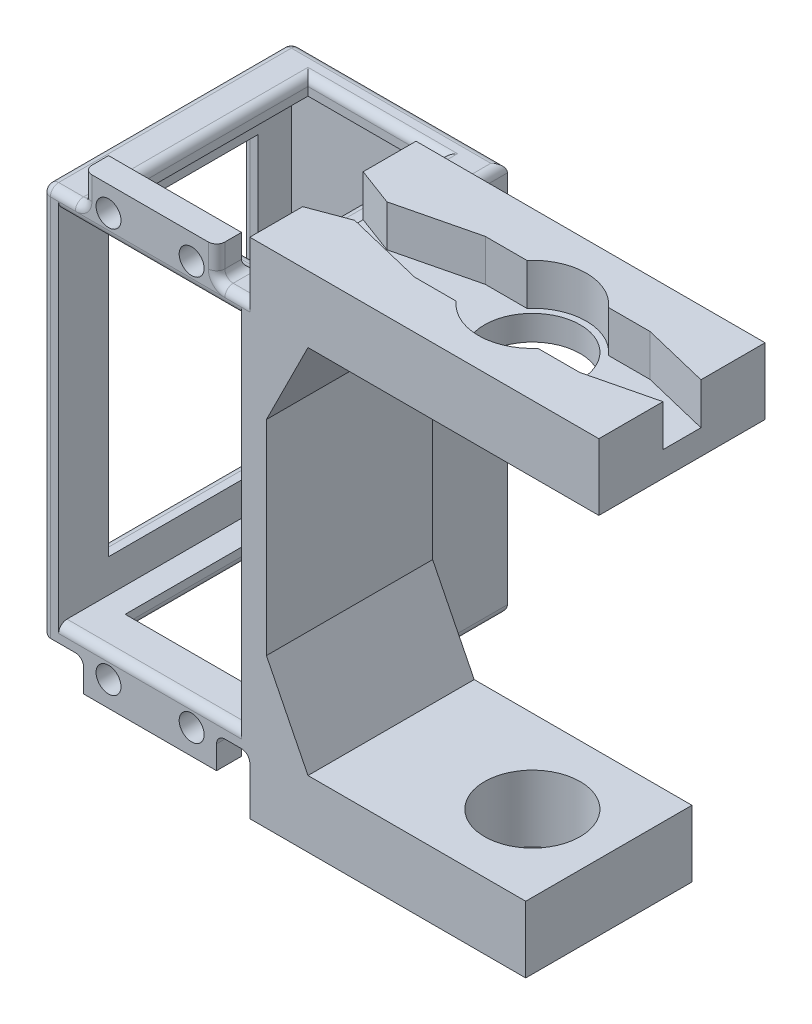
from build123d import *

# Parameters (mm, degrees)
SKETCH1_W               = 26
SKETCH1_H               = 47
BOSS_EXTRUDE1_DEPTH     = 30
SHELL1_T                = -2
SKETCH2_W               = 10
SKETCH2_H               = 0.8
BOSS_EXTRUDE2_DEPTH     = 3
SKETCH3_R               = 1.5
CUT_EXTRUDE1_DEPTH      = 3
BOSS_EXTRUDE3_DEPTH     = 20
CUT_EXTRUDE2_DEPTH      = 82.134209801
CUT_EXTRUDE2_DEPTH_BACK = 82.134209801
SKETCH6_R               = 4.5
BOSS_EXTRUDE4_DEPTH     = 8
CUT_EXTRUDE3_DEPTH      = 82.917275345
CUT_EXTRUDE3_DEPTH_BACK = 82.917275345
SKETCH9_R               = 5.75
CUT_EXTRUDE4_DEPTH      = 5
SKETCH10_W              = 18
SKETCH10_H              = 35
CUT_EXTRUDE5_DEPTH      = 5
FILLET1_R               = 1
FILLET2_R               = 1
FILLET3_R               = 1
FILLET5_R               = 1
FILLET6_R               = 1
SKETCH11_W              = 8.801922924
SKETCH11_H              = 20
CUT_EXTRUDE6_DEPTH      = 10


# Some blends are built 0.0001 mm under size
with BuildPart() as part:
    # Sketch1 → Boss-Extrude1 (new body)
    with BuildSketch(Plane.XY):
        Rectangle(SKETCH1_W, SKETCH1_H)
    extrude(amount=BOSS_EXTRUDE1_DEPTH)

    # Shell1
    shell1_openings = [part.faces().sort_by_distance(p)[0] for p in [
        (0, 0, 30),
    ]]
    offset(amount=SHELL1_T, openings=shell1_openings, kind=Kind.INTERSECTION)

    # Sketch2 → Boss-Extrude2 (add)
    with BuildSketch(Plane.XY.offset(30)):
        Polygon((-5, 23.5), (-5, 24.3), (5, 24.3), (5, 23.5), (8, 23.5), (8, 27.3), (-8, 27.3), (-8, 23.5), align=None)
        with Locations((0, 23.9)):
            Rectangle(SKETCH2_W, SKETCH2_H)
        Polygon((-5, -24.3), (-5, -23.5), (-8, -23.5), (-8, -27.3), (8, -27.3), (8, -23.5), (5, -23.5), (5, -24.3), align=None)
        with Locations((0, -23.9)):
            Rectangle(SKETCH2_W, SKETCH2_H)
    extrude(amount=-BOSS_EXTRUDE2_DEPTH)

    # Sketch3 → Cut-Extrude1 (cut)
    with BuildSketch(Plane.XY.offset(30)):
        with Locations((-5, -24.3)):
            Circle(SKETCH3_R)
        with Locations((5, -24.3)):
            Circle(SKETCH3_R)
        with Locations((5, 24.3)):
            Circle(SKETCH3_R)
        with Locations((-5, 24.3)):
            Circle(SKETCH3_R)
    extrude(amount=-CUT_EXTRUDE1_DEPTH, mode=Mode.SUBTRACT)

    # Sketch4 → Boss-Extrude3 (add)
    with BuildSketch(Plane.XY.offset(30)):
        Polygon((13, 23.5), (13, -23.5), (12, -23.5), (12, -30.3), (54, -30.3), (54, -22.3), (19, -22.3), (14, -12.3), (14, 12.3), (19, 22.3), (54, 22.3), (54, 30.3), (12, 30.3), (12, 23.5), align=None)
    extrude(amount=-BOSS_EXTRUDE3_DEPTH)

    # Sketch5 → Cut-Extrude2 (cut, two sides: drawn at the far end of the back side and taken through both)
    with BuildSketch(Plane(origin=(0, 22.3, 0), x_dir=(-1, 0, 0), z_dir=(0, -1, 0)).offset(-CUT_EXTRUDE2_DEPTH_BACK)):
        with BuildLine():
            ThreePointArc((-36, -14.25), (-41.75, -20), (-36, -25.75))
            Line((-36, -25.75), (-36, -14.25))
        make_face()
        with BuildLine():
            Line((-36, -14.25), (-36, -25.75))
            ThreePointArc((-36, -25.75), (-31.934136008, -24.065863992), (-30.25, -20))
            ThreePointArc((-30.25, -20), (-31.934136008, -15.934136008), (-36, -14.25))
        make_face()
    extrude(amount=CUT_EXTRUDE2_DEPTH + CUT_EXTRUDE2_DEPTH_BACK, mode=Mode.SUBTRACT)

    # Sketch6 → Boss-Extrude4 (add)
    with BuildSketch(Plane(origin=(0, 0, 0), x_dir=(-1, 0, 0), z_dir=(0, 0, -1))):
        with Locations((0, -10)):
            Circle(SKETCH6_R)
    extrude(amount=BOSS_EXTRUDE4_DEPTH)

    # Sketch7 → Cut-Extrude3 (cut, two sides: drawn at the far end of the back side and taken through both)
    with BuildSketch(Plane(origin=(0, 23.5, 0), x_dir=(1, 0, 0), z_dir=(0, 1, 0)).offset(-CUT_EXTRUDE3_DEPTH_BACK)):
        Polygon((-8, -25), (8, -25), (8, -23), (8, -5), (8, -3), (-8, -3), (-8, -5), (-8, -23), align=None)
    extrude(amount=CUT_EXTRUDE3_DEPTH + CUT_EXTRUDE3_DEPTH_BACK, mode=Mode.SUBTRACT)

    # Sketch9 → Cut-Extrude4 (cut)
    with BuildSketch(Plane(origin=(0, 30.3, 0), x_dir=(1, 0, 0), z_dir=(0, 1, 0))):
        with BuildLine():
            Line((31.081921107, -15.75), (26.081921107, -15.75))
            Line((26.081921107, -15.75), (16.559525756, -18.066028235))
            Line((16.559525756, -18.066028235), (12, -16.361741342))
            Line((12, -16.361741342), (12, -23.638258658))
            Line((12, -23.638258658), (16.559525756, -21.933971765))
            Line((16.559525756, -21.933971765), (26.081921107, -24.25))
            Line((26.081921107, -24.25), (31.081921107, -24.25))
            ThreePointArc((31.081921107, -24.25), (36, -26.5), (40.918078893, -24.25))
            Line((40.918078893, -24.25), (45.918078893, -24.25))
            Line((45.918078893, -24.25), (54, -22.284322585))
            Line((54, -22.284322585), (54, -17.715677415))
            Line((54, -17.715677415), (45.918078893, -15.75))
            Line((45.918078893, -15.75), (40.918078893, -15.75))
            ThreePointArc((40.918078893, -15.75), (36, -13.5), (31.081921107, -15.75))
        make_face()
        with Locations(Location((36, -20, 0), (0, 0, 90))):
            Circle(SKETCH9_R, mode=Mode.SUBTRACT)
    extrude(amount=-CUT_EXTRUDE4_DEPTH, mode=Mode.SUBTRACT)

    # Sketch10 → Cut-Extrude5 (cut)
    with BuildSketch(Plane.ZY.offset(13)):
        with Locations((15, 0)):
            Rectangle(SKETCH10_W, SKETCH10_H)
    extrude(amount=-CUT_EXTRUDE5_DEPTH, mode=Mode.SUBTRACT)

    # Fillet1
    fillet1_edges = [part.edges().sort_by_distance(p)[0] for p in [
        (0, -21.5, 30),
        (-13, 17.5, 15),
        (-13, 0, 24),
        (-13, 0, 6),
        (-13, -17.5, 15),
    ]]
    fillet(fillet1_edges, radius=FILLET1_R)

    # Fillet2
    # the kernel refuses this fillet: 1 mm, written as the material it adds along each edge
    with BuildSketch(Plane(origin=(8, 23.5, 30), x_dir=(1, 0, 0), z_dir=(0, 0, -1))) as fillet2_piece_1:
        with BuildLine():
            CenterArc((FILLET2_R, -FILLET2_R), FILLET2_R, 90, 90)
            Line((0, -FILLET2_R), (-FILLET2_R * 0.02, -FILLET2_R))
            Line((-FILLET2_R * 0.02, -FILLET2_R), (-FILLET2_R * 0.02, FILLET2_R * 0.02))
            Line((-FILLET2_R * 0.02, FILLET2_R * 0.02), (FILLET2_R, FILLET2_R * 0.02))
            Line((FILLET2_R, FILLET2_R * 0.02), (FILLET2_R, 0))
        make_face()
    extrude(amount=3)
    with BuildSketch(Plane(origin=(-8, 23.5, 30), x_dir=(-1, 0, 0), z_dir=(0, 0, -1))) as fillet2_piece_2:
        with BuildLine():
            CenterArc((FILLET2_R, FILLET2_R), FILLET2_R, 180, 90)
            Line((0, FILLET2_R), (-FILLET2_R * 0.02, FILLET2_R))
            Line((-FILLET2_R * 0.02, FILLET2_R), (-FILLET2_R * 0.02, -FILLET2_R * 0.02))
            Line((-FILLET2_R * 0.02, -FILLET2_R * 0.02), (FILLET2_R, -FILLET2_R * 0.02))
            Line((FILLET2_R, -FILLET2_R * 0.02), (FILLET2_R, 0))
        make_face()
    extrude(amount=3)
    with BuildSketch(Plane(origin=(3.768857754, 23.5, 27), x_dir=(0, 0, -1), z_dir=(1, 0, 0))) as fillet2_piece_3_section:
        with BuildLine():
            CenterArc((FILLET2_R, FILLET2_R), FILLET2_R, 180, 90)
            Line((0, FILLET2_R), (-FILLET2_R * 0.02, FILLET2_R))
            Line((-FILLET2_R * 0.02, FILLET2_R), (-FILLET2_R * 0.02, -FILLET2_R * 0.02))
            Line((-FILLET2_R * 0.02, -FILLET2_R * 0.02), (FILLET2_R, -FILLET2_R * 0.02))
            Line((FILLET2_R, -FILLET2_R * 0.02), (FILLET2_R, 0))
        make_face()
    fillet2_piece_3 = extrude(amount=4.231142246, mode=Mode.PRIVATE)
    fillet2_piece_3 = split(fillet2_piece_3, bisect_by=Plane(origin=(7.179036581, 23.695460756, 27), z_dir=(0, 0, -1)), keep=Keep.TOP, mode=Mode.PRIVATE)
    fillet2_piece_3 = fillet2_piece_3 - Plane(origin=(5, 24.3, 26.747269996), x_dir=(1, 0, 0), z_dir=(0, 0, 1)) * Cylinder(1.5, 13, mode=Mode.PRIVATE)
    add(fillet2_piece_3)
    with BuildSketch(Plane(origin=(12, -23.5, 30), x_dir=(0, -1, 0), z_dir=(0, 0, -1))) as fillet2_piece_4:
        with BuildLine():
            CenterArc((FILLET2_R, FILLET2_R), FILLET2_R, 180, 90)
            Line((0, FILLET2_R), (-FILLET2_R * 0.02, FILLET2_R))
            Line((-FILLET2_R * 0.02, FILLET2_R), (-FILLET2_R * 0.02, -FILLET2_R * 0.02))
            Line((-FILLET2_R * 0.02, -FILLET2_R * 0.02), (FILLET2_R, -FILLET2_R * 0.02))
            Line((FILLET2_R, -FILLET2_R * 0.02), (FILLET2_R, 0))
        make_face()
    extrude(amount=20)
    with BuildSketch(Plane(origin=(8, 23.5, 30), x_dir=(1, 0, 0), z_dir=(0, 0, -1))) as fillet2_piece_5a_section:
        with BuildLine():
            CenterArc((FILLET2_R, -FILLET2_R), FILLET2_R, 90, 90)
            Line((0, -FILLET2_R), (-FILLET2_R * 0.02, -FILLET2_R))
            Line((-FILLET2_R * 0.02, -FILLET2_R), (-FILLET2_R * 0.02, FILLET2_R * 0.02))
            Line((-FILLET2_R * 0.02, FILLET2_R * 0.02), (FILLET2_R, FILLET2_R * 0.02))
            Line((FILLET2_R, FILLET2_R * 0.02), (FILLET2_R, 0))
        make_face()
    fillet2_piece_5a = extrude(amount=5.5, mode=Mode.PRIVATE)
    fillet2_piece_5a = split(fillet2_piece_5a, bisect_by=Plane(origin=(8.226395114, 23.726395114, 27), z_dir=(0, 0, -1)), keep=Keep.TOP, mode=Mode.PRIVATE)
    with BuildSketch(Plane(origin=(3.768857754, 23.5, 27), x_dir=(0, 0, -1), z_dir=(1, 0, 0))) as fillet2_piece_5b_section:
        with BuildLine():
            CenterArc((FILLET2_R, FILLET2_R), FILLET2_R, 180, 90)
            Line((0, FILLET2_R), (-FILLET2_R * 0.02, FILLET2_R))
            Line((-FILLET2_R * 0.02, FILLET2_R), (-FILLET2_R * 0.02, -FILLET2_R * 0.02))
            Line((-FILLET2_R * 0.02, -FILLET2_R * 0.02), (FILLET2_R, -FILLET2_R * 0.02))
            Line((FILLET2_R, -FILLET2_R * 0.02), (FILLET2_R, 0))
        make_face()
    fillet2_piece_5b = extrude(amount=6.731142246, mode=Mode.PRIVATE)
    fillet2_piece_5b = split(fillet2_piece_5b, bisect_by=Plane(origin=(9.25, 23.70347313, 27), z_dir=(0, 0, -1)), keep=Keep.TOP, mode=Mode.PRIVATE)
    fillet2_piece_5b = split(fillet2_piece_5b, bisect_by=Plane(origin=(8, 23.70347313, 26.75304895), z_dir=(1, 0, 0)), keep=Keep.TOP, mode=Mode.PRIVATE)
    fillet2_piece_5 = fillet2_piece_5a & fillet2_piece_5b
    add(fillet2_piece_5)

    # Fillet3
    # the kernel refuses this fillet: 1 mm, written as the material it adds along each edge
    with BuildSketch(Plane(origin=(-8, -23.5, 30), x_dir=(-1, 0, 0), z_dir=(0, 0, -1))) as fillet3_piece_1:
        with BuildLine():
            CenterArc((FILLET3_R, -FILLET3_R), FILLET3_R, 90, 90)
            Line((0, -FILLET3_R), (-FILLET3_R * 0.02, -FILLET3_R))
            Line((-FILLET3_R * 0.02, -FILLET3_R), (-FILLET3_R * 0.02, FILLET3_R * 0.02))
            Line((-FILLET3_R * 0.02, FILLET3_R * 0.02), (FILLET3_R, FILLET3_R * 0.02))
            Line((FILLET3_R, FILLET3_R * 0.02), (FILLET3_R, 0))
        make_face()
    extrude(amount=3)
    with BuildSketch(Plane(origin=(8, -23.5, 30), x_dir=(1, 0, 0), z_dir=(0, 0, -1))) as fillet3_piece_2:
        with BuildLine():
            CenterArc((FILLET3_R, FILLET3_R), FILLET3_R, 180, 90)
            Line((0, FILLET3_R), (-FILLET3_R * 0.02, FILLET3_R))
            Line((-FILLET3_R * 0.02, FILLET3_R), (-FILLET3_R * 0.02, -FILLET3_R * 0.02))
            Line((-FILLET3_R * 0.02, -FILLET3_R * 0.02), (FILLET3_R, -FILLET3_R * 0.02))
            Line((FILLET3_R, -FILLET3_R * 0.02), (FILLET3_R, 0))
        make_face()
    extrude(amount=3)
    with BuildSketch(Plane(origin=(-3.768857754, -23.5, 27), x_dir=(0, 0, -1), z_dir=(-1, 0, 0))) as fillet3_piece_3_section:
        with BuildLine():
            CenterArc((FILLET3_R, FILLET3_R), FILLET3_R, 180, 90)
            Line((0, FILLET3_R), (-FILLET3_R * 0.02, FILLET3_R))
            Line((-FILLET3_R * 0.02, FILLET3_R), (-FILLET3_R * 0.02, -FILLET3_R * 0.02))
            Line((-FILLET3_R * 0.02, -FILLET3_R * 0.02), (FILLET3_R, -FILLET3_R * 0.02))
            Line((FILLET3_R, -FILLET3_R * 0.02), (FILLET3_R, 0))
        make_face()
    fillet3_piece_3 = extrude(amount=4.231142246, mode=Mode.PRIVATE)
    fillet3_piece_3 = split(fillet3_piece_3, bisect_by=Plane(origin=(-7.179037039, -23.695460726, 27), z_dir=(0, 0, -1)), keep=Keep.TOP, mode=Mode.PRIVATE)
    fillet3_piece_3 = fillet3_piece_3 - Plane(origin=(-5, -24.3, 26.747269962), x_dir=(1, 0, 0), z_dir=(0, 0, 1)) * Cylinder(1.5, 13, mode=Mode.PRIVATE)
    add(fillet3_piece_3)
    with BuildSketch(Plane(origin=(-3.768857754, -23.5, 27), x_dir=(0, 0, -1), z_dir=(-1, 0, 0))) as fillet3_piece_4a_section:
        with BuildLine():
            CenterArc((FILLET3_R, FILLET3_R), FILLET3_R, 180, 90)
            Line((0, FILLET3_R), (-FILLET3_R * 0.02, FILLET3_R))
            Line((-FILLET3_R * 0.02, FILLET3_R), (-FILLET3_R * 0.02, -FILLET3_R * 0.02))
            Line((-FILLET3_R * 0.02, -FILLET3_R * 0.02), (FILLET3_R, -FILLET3_R * 0.02))
            Line((FILLET3_R, -FILLET3_R * 0.02), (FILLET3_R, 0))
        make_face()
    fillet3_piece_4a = extrude(amount=6.731142246, mode=Mode.PRIVATE)
    fillet3_piece_4a = split(fillet3_piece_4a, bisect_by=Plane(origin=(-9.25, -23.70347313, 27), z_dir=(0, 0, -1)), keep=Keep.TOP, mode=Mode.PRIVATE)
    fillet3_piece_4a = split(fillet3_piece_4a, bisect_by=Plane(origin=(-8, -23.70347313, 26.75304895), z_dir=(-1, 0, 0)), keep=Keep.TOP, mode=Mode.PRIVATE)
    with BuildSketch(Plane(origin=(-8, -23.5, 30), x_dir=(-1, 0, 0), z_dir=(0, 0, -1))) as fillet3_piece_4b_section:
        with BuildLine():
            CenterArc((FILLET3_R, -FILLET3_R), FILLET3_R, 90, 90)
            Line((0, -FILLET3_R), (-FILLET3_R * 0.02, -FILLET3_R))
            Line((-FILLET3_R * 0.02, -FILLET3_R), (-FILLET3_R * 0.02, FILLET3_R * 0.02))
            Line((-FILLET3_R * 0.02, FILLET3_R * 0.02), (FILLET3_R, FILLET3_R * 0.02))
            Line((FILLET3_R, FILLET3_R * 0.02), (FILLET3_R, 0))
        make_face()
    fillet3_piece_4b = extrude(amount=5.5, mode=Mode.PRIVATE)
    fillet3_piece_4b = split(fillet3_piece_4b, bisect_by=Plane(origin=(-8.226395114, -23.726395114, 27), z_dir=(0, 0, -1)), keep=Keep.TOP, mode=Mode.PRIVATE)
    fillet3_piece_4 = fillet3_piece_4a & fillet3_piece_4b
    add(fillet3_piece_4)

    # Fillet5
    fillet5_edges = [part.edges().sort_by_distance(p)[0] for p in [
        (-11, 23.5, 30),
        (-8, 23.5, 14),
        (0, 23.5, 3),
        (0, -23.5, 3),
        (8, 23.5, 14),
        (8, -23.5, 14),
        (0, 23.5, 25),
        (-8, -23.5, 14),
        (0, -23.5, 25),
        (-13, 0, 30),
        (8, 25.9, 30),
        (10.5, 23.5, 30),
        (-8, 25.9, 30),
        (-8.292893219, 23.792893219, 30),
        (8.292893219, 23.792893219, 30),
        (-13, 0, 0),
        (0, 23.5, 0),
        (0, -23.5, 0),
        (-13, -23.5, 15),
        (-13, 23.5, 15),
        (13, 23.5, 5),
        (13, -23.5, 5),
    ]]
    fillet(fillet5_edges, radius=FILLET5_R - 0.0001)  # a hair under: the kernel refuses the full size

    # Fillet6
    fillet6_edges = [part.edges().sort_by_distance(p)[0] for p in [
        (0, 21.5, 30),
    ]]
    fillet(fillet6_edges, radius=FILLET6_R)

    # Sketch11 → Cut-Extrude6 (cut)
    with BuildSketch(Plane.XZ.offset(30.3)):
        with Locations((49.599038538, 20)):
            Rectangle(SKETCH11_W, SKETCH11_H)
    extrude(amount=-CUT_EXTRUDE6_DEPTH, mode=Mode.SUBTRACT)


solid = part.part
